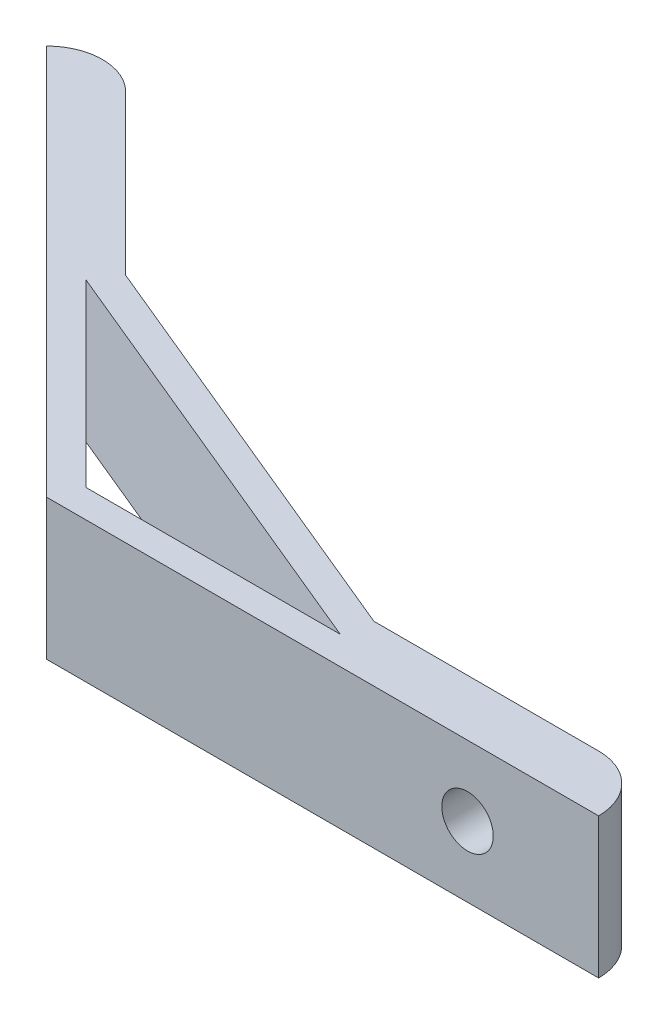
from build123d import *

# Parameters (mm, degrees)
BOSS_EXTRUDE1_DEPTH = 15
FILLET1_R           = 6
CUT_EXTRUDE1_DEPTH  = 111.72308217
SKETCH3_R           = 2.75
CUT_EXTRUDE2_DEPTH  = 109.507513635
SKETCH4_R           = 2.75
CUT_EXTRUDE3_DEPTH  = 104.169159776


with BuildPart() as part:
    # Sketch1 → Boss-Extrude1 (new body)
    with BuildSketch(Plane(origin=(0, 0, 0), x_dir=(1, 0, 0), z_dir=(0, 1, 0))):
        Polygon((0, 0), (-59, 0), (-100.71930009, 41.71930009), (-96.476659403, 45.961940777), (-75.263455967, 24.748737342), (-30, 6), (0, 6), align=None)
    extrude(amount=BOSS_EXTRUDE1_DEPTH)

    # Fillet1
    fillet1_edges = [part.edges().sort_by_distance(p)[0] for p in [
        (-96.476659403, 7.5, -45.961940777),
        (0, 7.5, -6),
    ]]
    fillet(fillet1_edges, radius=FILLET1_R - 0.0001)  # a hair under: the kernel refuses the full size

    # Sketch2 → Cut-Extrude1 (cut, through all)
    with BuildSketch(Plane(origin=(0, 15, 0), x_dir=(1, 0, 0), z_dir=(0, 1, 0))):
        Polygon((-76.962819459, 22.205460146), (-30.596737102, 3), (-57.757359313, 3), align=None)
    extrude(amount=-CUT_EXTRUDE1_DEPTH, mode=Mode.SUBTRACT)

    # Sketch3 → Cut-Extrude2 (cut, through all)
    with BuildSketch(Plane(origin=(0, 0, -6), x_dir=(-1, 0, 0), z_dir=(0, 0, -1))):
        with Locations((14, 7.5)):
            Circle(SKETCH3_R)
    extrude(amount=-CUT_EXTRUDE2_DEPTH, mode=Mode.SUBTRACT)

    # Sketch4 → Cut-Extrude3 (cut, through all)
    with BuildSketch(Plane(origin=(-25.257359313, 0, 25.257359313), x_dir=(-0.7071067811865465, 0, -0.7071067811865487), z_dir=(0.7071067811865487, 0, -0.7071067811865465))):
        with Locations((86.71930009, 7.5)):
            Circle(SKETCH4_R)
    extrude(amount=-CUT_EXTRUDE3_DEPTH, mode=Mode.SUBTRACT)


solid = part.part
